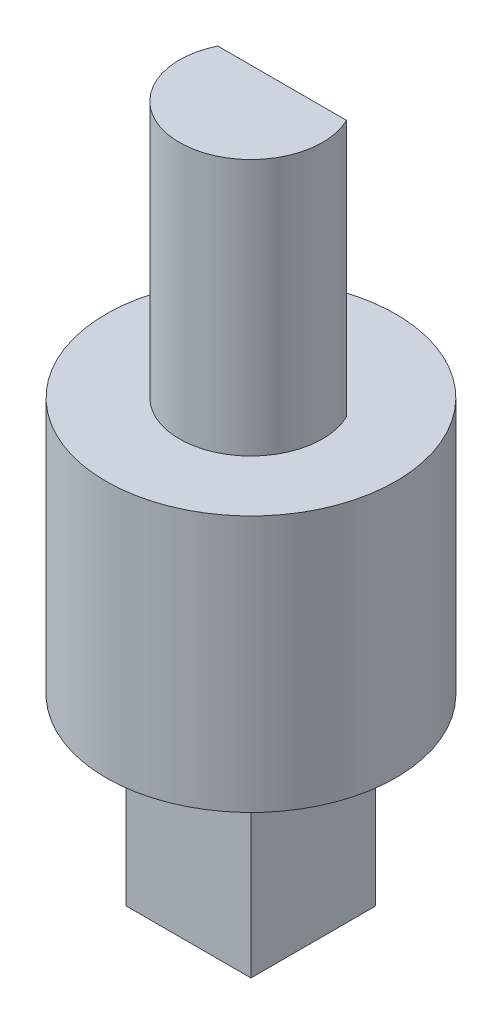
from build123d import *

# Parameters (mm, degrees)
SKETCH1_W           = 3.4
SKETCH1_H           = 3.4
BOSS_EXTRUDE1_DEPTH = 5
SKETCH2_R           = 3.95
BOSS_EXTRUDE2_DEPTH = 7
SKETCH3_R           = 1.95
BOSS_EXTRUDE3_DEPTH = 7
CUT_EXTRUDE1_START  = -7
CUT_EXTRUDE1_DEPTH  = 7


with BuildPart() as part:
    # Sketch1 → Boss-Extrude1 (new body)
    with BuildSketch(Plane(origin=(0, 0, 0), x_dir=(1, 0, 0), z_dir=(0, 1, 0))):
        Rectangle(SKETCH1_W, SKETCH1_H)
    extrude(amount=BOSS_EXTRUDE1_DEPTH)

    # Sketch2 → Boss-Extrude2 (add)
    with BuildSketch(Plane(origin=(0, 5, 0), x_dir=(1, 0, 0), z_dir=(0, 1, 0))):
        Circle(SKETCH2_R)
    extrude(amount=BOSS_EXTRUDE2_DEPTH)

    # Sketch3 → Boss-Extrude3 (add)
    with BuildSketch(Plane(origin=(0, 12, 0), x_dir=(1, 0, 0), z_dir=(0, 1, 0))):
        Circle(SKETCH3_R)
    extrude(amount=BOSS_EXTRUDE3_DEPTH)

    # Sketch4 → Cut-Extrude1 (cut)
    with BuildSketch(Plane(origin=(0, 19, 0), x_dir=(1, 0, 0), z_dir=(0, 1, 0)).offset(CUT_EXTRUDE1_START)):
        with BuildLine():
            Line((-1.754992877, 0.85), (1.754992877, 0.85))
            ThreePointArc((1.754992877, 0.85), (0, 1.95), (-1.754992877, 0.85))
        make_face()
    extrude(amount=CUT_EXTRUDE1_DEPTH, mode=Mode.SUBTRACT)


solid = part.part
